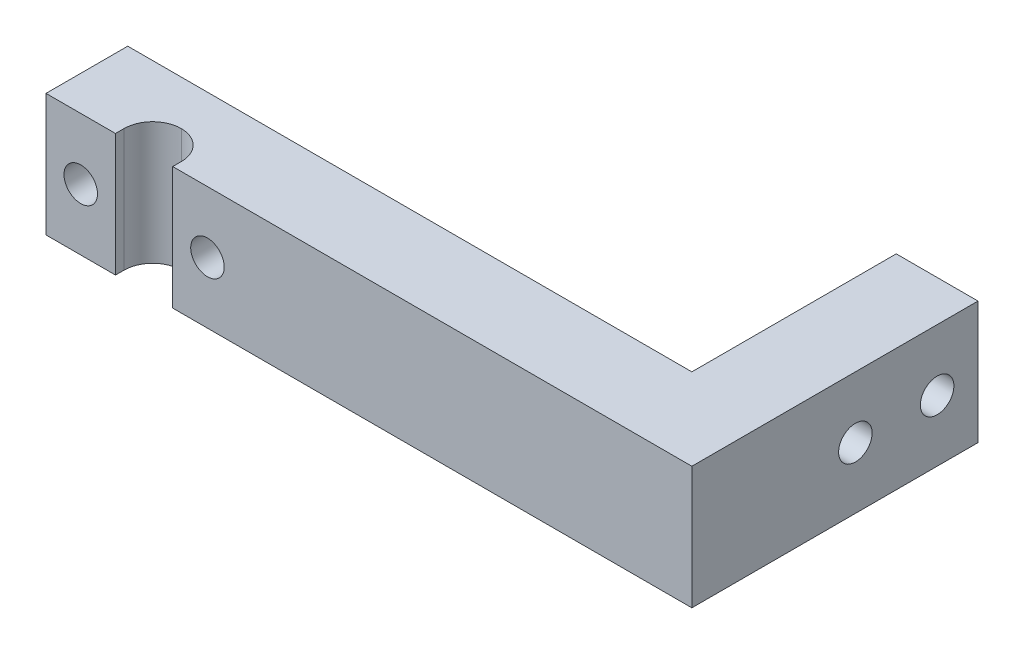
from build123d import *

# Parameters (mm, degrees)
BOSS_EXTRUDE1_DEPTH = 30
SKETCH3_R           = 4.1
CUT_EXTRUDE1_DEPTH  = 81.160460929
SKETCH4_R           = 4.1
CUT_EXTRUDE2_DEPTH  = 72.938334134
FILLET1_R           = 7
BOSS_EXTRUDE2_DEPTH = 30
SKETCH7_R           = 4.1
CUT_EXTRUDE3_DEPTH  = 154.802223385
SKETCH8_W           = 10
SKETCH8_H           = 50
CUT_EXTRUDE4_DEPTH  = 151.209521461


with BuildPart() as part:
    # Sketch1 → Boss-Extrude1 (new body)
    with BuildSketch(Plane(origin=(0, 0, 0), x_dir=(1, 0, 0), z_dir=(0, 1, 0))):
        Polygon((-22.986013986, 8.601398601), (-22.986013986, -11.398601399), (-5.986013986, -11.398601399), (-5.986013986, -2.307692308), (8.013986014, -2.307692308), (8.013986014, -11.398601399), (25.013986014, -11.398601399), (25.013986014, 8.601398601), (6.013986014, 8.601398601), (6.013986014, 58.601398601), (-3.986013986, 58.601398601), (-3.986013986, 8.601398601), align=None)
    extrude(amount=BOSS_EXTRUDE1_DEPTH)

    # Sketch3 → Cut-Extrude1 (cut, through all)
    with BuildSketch(Plane.XY.offset(11.398601399)):
        with Locations((-14.486013986, 15)):
            Circle(SKETCH3_R)
        with Locations((16.513986014, 15)):
            Circle(SKETCH3_R)
    extrude(amount=-CUT_EXTRUDE1_DEPTH, mode=Mode.SUBTRACT)

    # Sketch4 → Cut-Extrude2 (cut, through all)
    with BuildSketch(Plane(origin=(6.013986014, 0, 0), x_dir=(0, 0, -1), z_dir=(1, 0, 0))):
        with Locations((28.601398601, 15)):
            Circle(SKETCH4_R)
        with Locations((48.601398601, 15)):
            Circle(SKETCH4_R)
    extrude(amount=-CUT_EXTRUDE2_DEPTH, mode=Mode.SUBTRACT)

    # Fillet1
    fillet1_edges = [part.edges().sort_by_distance(p)[0] for p in [
        (-5.986013986, 15, 2.307692308),
        (8.013986014, 15, 2.307692308),
    ]]
    fillet(fillet1_edges, radius=FILLET1_R - 0.0001)  # a hair under: the kernel refuses the full size

    # Sketch6 → Boss-Extrude2 (add)
    with BuildSketch(Plane.XZ):
        Polygon((25.013986014, 11.398601399), (135.013986014, 11.398601399), (135.013986014, -58.601398601), (115.013986014, -58.601398601), (115.013986014, -8.601398601), (25.013986014, -8.601398601), align=None)
    extrude(amount=-BOSS_EXTRUDE2_DEPTH)

    # Sketch7 → Cut-Extrude3 (cut, through all)
    with BuildSketch(Plane.ZY.offset(3.986013986)):
        with Locations(Location((-48.601398601, 15, 0), (0, 0, 180))):
            Circle(SKETCH7_R)
        with Locations(Location((-28.601398601, 15, 0), (0, 0, 180))):
            Circle(SKETCH7_R)
    extrude(amount=-CUT_EXTRUDE3_DEPTH, mode=Mode.SUBTRACT)

    # Sketch8 → Cut-Extrude4 (cut, through all)
    with BuildSketch(Plane(origin=(0, 30, 0), x_dir=(1, 0, 0), z_dir=(0, 1, 0))):
        with Locations((1.013986014, 33.601398601)):
            Rectangle(SKETCH8_W, SKETCH8_H)
    extrude(amount=-CUT_EXTRUDE4_DEPTH, mode=Mode.SUBTRACT)


solid = part.part
